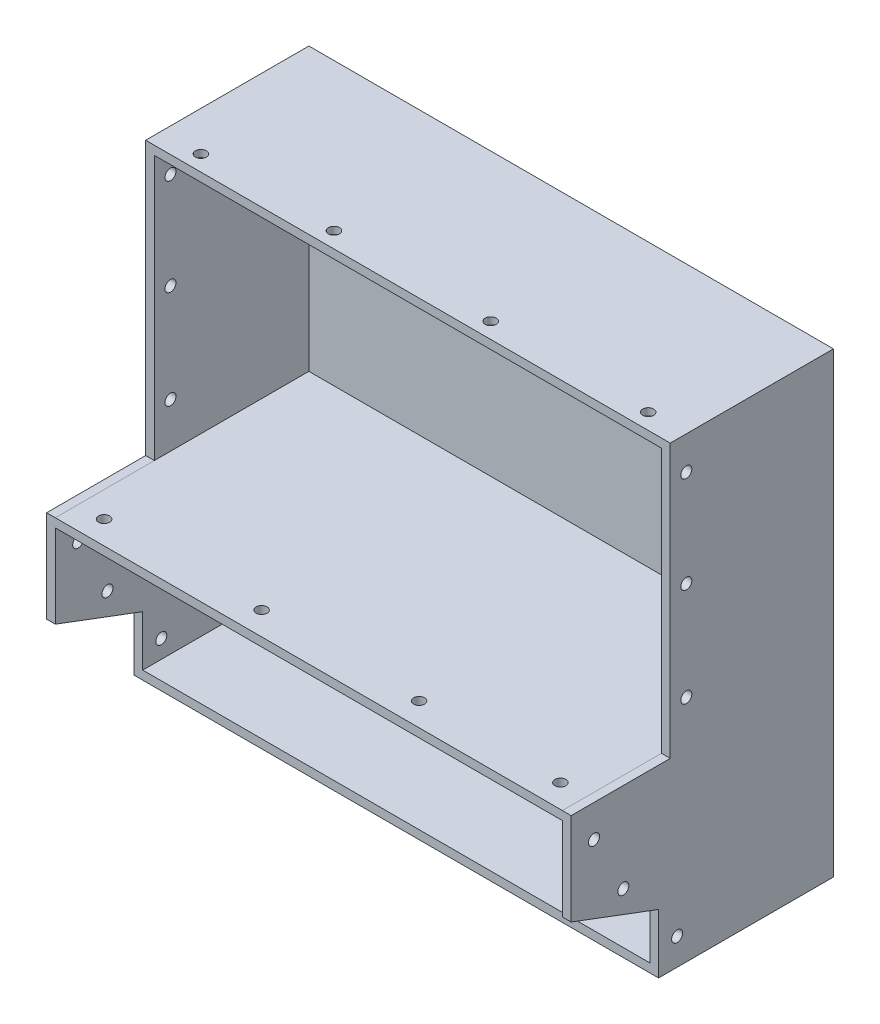
from build123d import *

# Parameters (mm, degrees)
SKETCH1_W           = 190.5
SKETCH1_H           = 166.116
BOSS_EXTRUDE1_DEPTH = 95.25
CUT_EXTRUDE1_DEPTH  = 92.075
CUT_EXTRUDE5_DEPTH  = 35.98418
SKETCH17_W          = 190.5
SKETCH17_H          = 33.474363619
CUT_EXTRUDE6_DEPTH  = 31.75
BOSS_EXTRUDE8_DEPTH = 190.5
SKETCH19_W          = 184.15
SKETCH19_H          = 30.313503047
CUT_EXTRUDE7_DEPTH  = 92.075
SKETCH20_W          = 184.15
SKETCH20_H          = 33.914711244
CUT_EXTRUDE8_DEPTH  = 13.175
CUT_EXTRUDE9_DEPTH  = 60.325
SKETCH23_R          = 2.00000108
CUT_EXTRUDE10_DEPTH = 2.54
SKETCH24_R          = 2
SKETCH24_R_2        = 2.00000108
CUT_EXTRUDE11_DEPTH = 2.54
SKETCH25_R          = 2.00000108
CUT_EXTRUDE12_DEPTH = 229.607619873
SKETCH27_R          = 2.00000108
CUT_EXTRUDE13_DEPTH = 3.175
SKETCH28_R          = 2.00000108
CUT_EXTRUDE15_DEPTH = 229.607619873


with BuildPart() as part:
    # Sketch1 → Boss-Extrude1 (new body)
    with BuildSketch(Plane.XY):
        Rectangle(SKETCH1_W, SKETCH1_H)
    extrude(amount=BOSS_EXTRUDE1_DEPTH)

    # Sketch3 → Cut-Extrude1 (cut)
    with BuildSketch(Plane.XY.offset(95.25)):
        Polygon((83.88326961, 79.883), (-81.085829842, 79.883), (-92.075, 79.883), (-92.075, 32.891702926), (-92.075, -16.095133334), (92.075, -16.095133334), (92.075, 48.662739539), (92.075, 79.883), align=None)
    extrude(amount=-CUT_EXTRUDE1_DEPTH, mode=Mode.SUBTRACT)

    # Sketch15 → Cut-Extrude5 (cut)
    with BuildSketch(Plane.XY.offset(95.25)):
        Polygon((95.25, -16.109272762), (95.25, 83.058), (-95.25, 83.058), (-95.25, -16.109272762), (-92.075, -16.095133334), (-92.075, 79.883), (92.075, 79.883), (92.075, -16.095133334), align=None)
    extrude(amount=-CUT_EXTRUDE5_DEPTH, mode=Mode.SUBTRACT)

    # Sketch17 → Cut-Extrude6 (cut)
    with BuildSketch(Plane.XY.offset(95.25)):
        with Locations((0, -66.320818191)):
            Rectangle(SKETCH17_W, SKETCH17_H)
    extrude(amount=-CUT_EXTRUDE6_DEPTH, mode=Mode.SUBTRACT)

    # Sketch18 → Boss-Extrude8 (add)
    with BuildSketch(Plane.ZY.offset(95.25)):
        Polygon((63.5, -49.583636381), (63.5, -61.506100001), (95.25, -49.583636381), align=None)
    extrude(amount=-BOSS_EXTRUDE8_DEPTH)

    # Sketch19 → Cut-Extrude7 (cut)
    with BuildSketch(Plane.XY.offset(95.25)):
        with Locations((0, -34.426884857)):
            Rectangle(SKETCH19_W, SKETCH19_H)
    extrude(amount=-CUT_EXTRUDE7_DEPTH, mode=Mode.SUBTRACT)

    # Sketch20 → Cut-Extrude8 (cut)
    with BuildSketch(Plane(origin=(0, -74.803163357, 28.08938563), x_dir=(1, 0, 0), z_dir=(0, -0.9361719099317519, 0.3515425366221503))):
        with Locations((0, 54.782261491)):
            Rectangle(SKETCH20_W, SKETCH20_H)
    extrude(amount=-CUT_EXTRUDE8_DEPTH, mode=Mode.SUBTRACT)

    # Sketch21 → Cut-Extrude9 (cut)
    with BuildSketch(Plane.XY.offset(63.5)):
        Polygon((-92.075, -61.506100001), (-92.075, -49.583636381), (92.075, -49.583636381), (92.075, -61.506100001), (92.075, -79.883), (-92.075, -79.883), align=None)
    extrude(amount=-CUT_EXTRUDE9_DEPTH, mode=Mode.SUBTRACT)

    # Sketch23 → Cut-Extrude10 (cut)
    with BuildSketch(Plane.XZ.offset(83.058)):
        with Locations((-82.849188623, 55.000696991)):
            Circle(SKETCH23_R)
        with Locations((-25.472016651, 55.000696991)):
            Circle(SKETCH23_R)
        with Locations((31.523609513, 55.000696991)):
            Circle(SKETCH23_R)
        with Locations((82.814656862, 55.000696991)):
            Circle(SKETCH23_R)
    extrude(amount=-CUT_EXTRUDE10_DEPTH, mode=Mode.SUBTRACT)

    # Sketch24 → Cut-Extrude11 (cut)
    with BuildSketch(Plane(origin=(0, 83.058, 0), x_dir=(1, 0, 0), z_dir=(0, 1, 0))):
        with Locations((81.523328712, -53.55082)):
            Circle(SKETCH24_R)
        with Locations((24.335748782, -53.55082)):
            Circle(SKETCH24_R_2)
        with Locations((-32.590719569, -53.55082)):
            Circle(SKETCH24_R_2)
        with Locations((-80.895203369, -53.55082)):
            Circle(SKETCH24_R_2)
    extrude(amount=-CUT_EXTRUDE11_DEPTH, mode=Mode.SUBTRACT)

    # Sketch25 → Cut-Extrude12 (cut, through all)
    with BuildSketch(Plane(origin=(95.25, 0, 0), x_dir=(0, 0, -1), z_dir=(1, 0, 0))):
        with Locations((-53.42382, 70.993)):
            Circle(SKETCH25_R)
        with Locations((-53.42382, 35.941)):
            Circle(SKETCH25_R)
        with Locations((-53.42382, 0.217760577)):
            Circle(SKETCH25_R)
    extrude(amount=-CUT_EXTRUDE12_DEPTH, mode=Mode.SUBTRACT)

    # Sketch27 → Cut-Extrude13 (cut)
    with BuildSketch(Plane(origin=(0, -16.095133334, 0), x_dir=(1, 0, 0), z_dir=(0, 1, 0))):
        with Locations((82.927784397, -86.822835397)):
            Circle(SKETCH27_R)
        with Locations((31.591922204, -86.822835397)):
            Circle(SKETCH27_R)
        with Locations((-25.602288215, -86.822835397)):
            Circle(SKETCH27_R)
        with Locations((-82.800527943, -86.822835397)):
            Circle(SKETCH27_R)
    extrude(amount=-CUT_EXTRUDE13_DEPTH, mode=Mode.SUBTRACT)

    # Sketch28 → Cut-Extrude15 (cut, through all)
    with BuildSketch(Plane(origin=(95.25, 0, 0), x_dir=(0, 0, -1), z_dir=(1, 0, 0))):
        with Locations((-56.76125, -73.285093297)):
            Circle(SKETCH28_R)
        with Locations((-76.306976382, -48.567809089)):
            Circle(SKETCH28_R)
        with Locations((-86.949753477, -27.794488932)):
            Circle(SKETCH28_R)
    extrude(amount=-CUT_EXTRUDE15_DEPTH, mode=Mode.SUBTRACT)


solid = part.part
